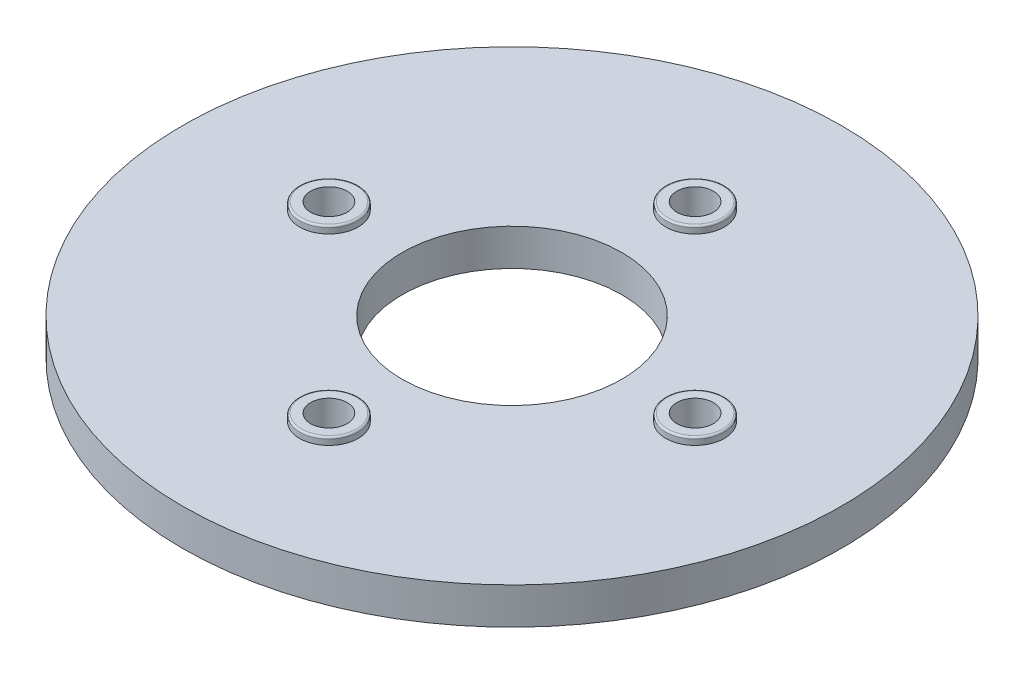
from build123d import *

# Parameters (mm, degrees)
SKETCH1_R           = 45
SKETCH1_R_2         = 2.5
SKETCH1_R_3         = 15
BOSS_EXTRUDE1_DEPTH = 5
SKETCH2_R           = 4
SKETCH2_R_2         = 2.5
BOSS_EXTRUDE2_DEPTH = 1
FILLET1_R           = 0.25


with BuildPart() as part:
    # Sketch1 → Boss-Extrude1 (new body)
    with BuildSketch(Plane(origin=(0, 0, 0), x_dir=(1, 0, 0), z_dir=(0, 1, 0))):
        Circle(SKETCH1_R)
        with Locations((0, 25)):
            Circle(SKETCH1_R_2, mode=Mode.SUBTRACT)
        with Locations((-25, 0)):
            Circle(SKETCH1_R_2, mode=Mode.SUBTRACT)
        with Locations((0, -25)):
            Circle(SKETCH1_R_2, mode=Mode.SUBTRACT)
        with Locations((25, 0)):
            Circle(SKETCH1_R_2, mode=Mode.SUBTRACT)
        Circle(SKETCH1_R_3, mode=Mode.SUBTRACT)
    extrude(amount=BOSS_EXTRUDE1_DEPTH)

    # Sketch2 → Boss-Extrude2 (add)
    # profile 1 of 4: a face of its own
    with BuildSketch(Plane(origin=(0, 5, 0), x_dir=(1, 0, 0), z_dir=(0, 1, 0))):
        with Locations((25, 0)):
            Circle(SKETCH2_R)
        with Locations((25, 0)):
            Circle(SKETCH2_R_2, mode=Mode.SUBTRACT)
    # profile 2 of 4: a face of its own
    with BuildSketch(Plane(origin=(0, 5, 0), x_dir=(1, 0, 0), z_dir=(0, 1, 0))):
        with Locations((0, 25)):
            Circle(SKETCH2_R)
        with Locations((0, 25)):
            Circle(SKETCH2_R_2, mode=Mode.SUBTRACT)
    # profile 3 of 4: a face of its own
    with BuildSketch(Plane(origin=(0, 5, 0), x_dir=(1, 0, 0), z_dir=(0, 1, 0))):
        with Locations((0, -25)):
            Circle(SKETCH2_R)
        with Locations((0, -25)):
            Circle(SKETCH2_R_2, mode=Mode.SUBTRACT)
    # profile 4 of 4: a face of its own
    with BuildSketch(Plane(origin=(0, 5, 0), x_dir=(1, 0, 0), z_dir=(0, 1, 0))):
        with Locations((-25, 0)):
            Circle(SKETCH2_R)
        with Locations((-25, 0)):
            Circle(SKETCH2_R_2, mode=Mode.SUBTRACT)
    extrude(amount=BOSS_EXTRUDE2_DEPTH)

    # Fillet1
    fillet1_edges = [part.edges().sort_by_distance(p)[0] for p in [
        (21, 6, 0),
        (-4, 6, 25),
        (-29, 6, 0),
        (-4, 6, -25),
    ]]
    fillet(fillet1_edges, radius=FILLET1_R)


solid = part.part
